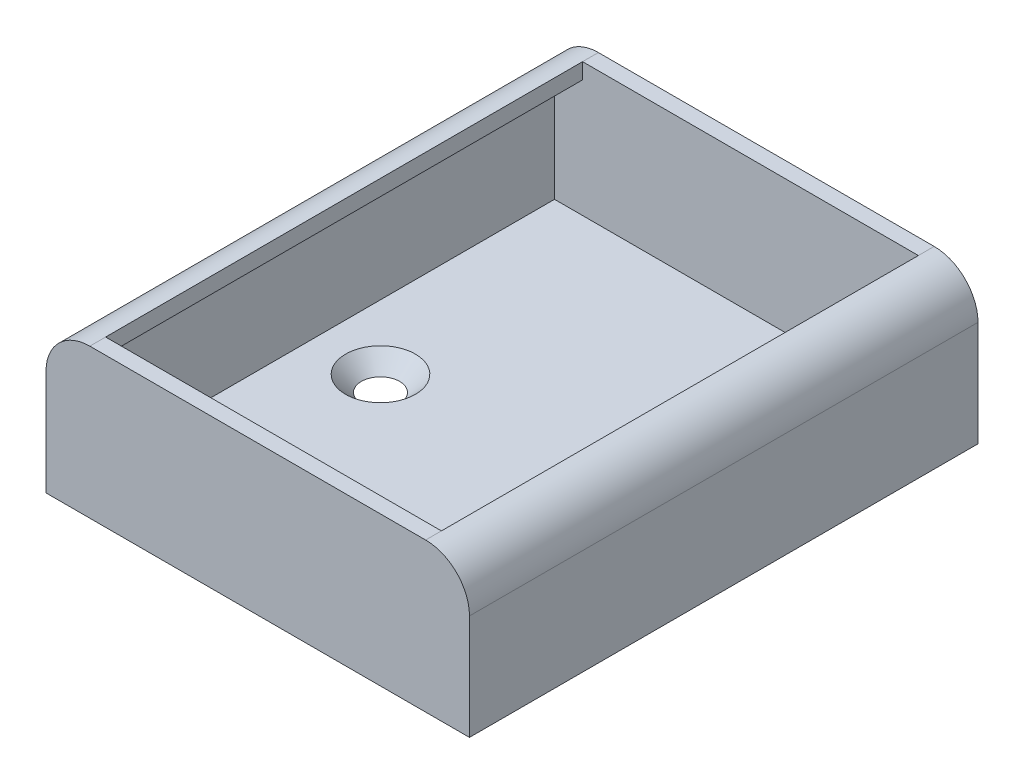
from build123d import *

# Parameters (mm, degrees)
SKETCH1_W           = 48.3
SKETCH1_H           = 58
BOSS_EXTRUDE1_DEPTH = 17
FILLET1_R           = 5
SHELL2_START        = -27.2
SHELL2_DEPTH        = 54.4
SKETCH2_R           = 1.75
CUT_EXTRUDE1_DEPTH  = 17
CHAMFER1_SIZE       = 2.23


# Read off the part's stored shape, not the designer's step: Shell2
with BuildPart() as part:
    # Sketch1 → Boss-Extrude1 (new body)
    with BuildSketch(Plane(origin=(0, 0, 0), x_dir=(1, 0, 0), z_dir=(0, 1, 0))):
        Rectangle(SKETCH1_W, SKETCH1_H)
    extrude(amount=BOSS_EXTRUDE1_DEPTH)

    # Fillet1
    fillet1_edges = [part.edges().sort_by_distance(p)[0] for p in [
        (-24.15, 17, 0),
        (24.15, 17, 0),
    ]]
    fillet(fillet1_edges, radius=FILLET1_R)

    # Shell2 outline → Shell2 (cut)
    with BuildSketch(Plane.XY.offset(SHELL2_START)):
        with BuildLine():
            Line((19.15, 15.2), (19.15, 17))
            Line((19.15, 17), (-19.15, 17))
            Line((-19.15, 17), (-19.15, 15.2))
            ThreePointArc((-19.15, 15.2), (-21.4127417, 14.2627417), (-22.35, 12))
            Line((-22.35, 12), (-22.35, 1.8))
            Line((-22.35, 1.8), (22.35, 1.8))
            Line((22.35, 1.8), (22.35, 12))
            ThreePointArc((22.35, 12), (21.4127417, 14.2627417), (19.15, 15.2))
        make_face()
    extrude(amount=SHELL2_DEPTH, mode=Mode.SUBTRACT)

    # Sketch2 → Cut-Extrude1 (cut)
    with BuildSketch(Plane(origin=(0, 1.8, 0), x_dir=(1, 0, 0), z_dir=(0, 1, 0))):
        with Locations(Location((-15, 0, 0), (0, 0, 270))):
            Circle(SKETCH2_R)
        with Locations(Location((15, 0, 0), (0, 0, 270))):
            Circle(SKETCH2_R)
    extrude(amount=-CUT_EXTRUDE1_DEPTH, mode=Mode.SUBTRACT)

    # Chamfer1
    # the kernel refuses this chamfer: 2.23 mm, written as the material it takes off along each edge
    with BuildSketch(Plane(origin=(-15, 1.8, 0), x_dir=(0, 0, 1), z_dir=(-1, 0, 0))) as chamfer1_piece_1:
        Polygon((1.75, -CHAMFER1_SIZE), (1.75 + CHAMFER1_SIZE, 0), (1.75, 0), align=None)
    revolve(axis=Axis((-15, 1.8, 0), (0, 1, 0)), mode=Mode.SUBTRACT)
    with BuildSketch(Plane(origin=(15, 1.8, 0), x_dir=(0, 0, 1), z_dir=(-1, 0, 0))) as chamfer1_piece_2:
        Polygon((1.75, -CHAMFER1_SIZE), (1.75 + CHAMFER1_SIZE, 0), (1.75, 0), align=None)
    revolve(axis=Axis((15, 1.8, 0), (0, 1, 0)), mode=Mode.SUBTRACT)


solid = part.part
